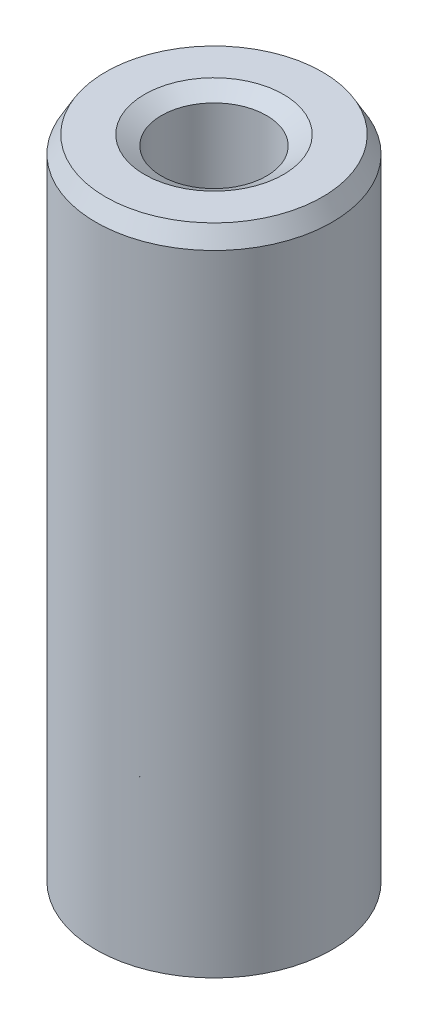
from build123d import *
from OCP.BRepFilletAPI import BRepFilletAPI_MakeChamfer

# Parameters (mm, degrees)
SKETCH1_R           = 17.5
BOSS_EXTRUDE1_DEPTH = 97.266417423
SKETCH2_R           = 7.778226496
CUT_EXTRUDE1_DEPTH  = 101.365611433
CHAMFER1_SIZE       = 2.512301637
CHAMFER1_SIZE2      = 1.450478026


with BuildPart() as part:
    # Sketch1 → Boss-Extrude1 (new body)
    with BuildSketch(Plane(origin=(0, 0, 0), x_dir=(1, 0, 0), z_dir=(0, 1, 0))):
        Circle(SKETCH1_R)
    extrude(amount=BOSS_EXTRUDE1_DEPTH)

    # Sketch2 → Cut-Extrude1 (cut, through all)
    with BuildSketch(Plane(origin=(0, 0, 0), x_dir=(1, 0, 0), z_dir=(0, 1, 0))):
        Circle(SKETCH2_R)
    extrude(amount=CUT_EXTRUDE1_DEPTH, mode=Mode.SUBTRACT)

    # Chamfer1: one chamfer whose edges measure the first distance from different faces: ONE call of the kernel's chamfer builder (chamfer() names one face for all edges)
    chamfer1_edges_1 = [part.edges().sort_by_distance(p)[0] for p in [
        (-7.778226496, 97.266417423, 0),
    ]]
    chamfer1_side_1 = [part.faces().sort_by_distance(p)[0] for p in [
        (-17.005025253, 97.266417423, 0),
    ]]
    chamfer1_edges_2 = [part.edges().sort_by_distance(p)[0] for p in [
        (-7.778226496, 0, 0),
    ]]
    chamfer1_side_2 = [part.faces().sort_by_distance(p)[0] for p in [
        (-7.778226496, 48.633208712, 0),
    ]]
    chamfer1_edges_3 = [part.edges().sort_by_distance(p)[0] for p in [
        (-17.5, 0, 0),
    ]]
    chamfer1_side_3 = [part.faces().sort_by_distance(p)[0] for p in [
        (-17.005025253, 0, 0),
    ]]
    chamfer1_edges_4 = [part.edges().sort_by_distance(p)[0] for p in [
        (-17.5, 97.266417423, 0),
    ]]
    chamfer1_side_4 = [part.faces().sort_by_distance(p)[0] for p in [
        (-17.5, 48.633208712, 0),
    ]]
    chamfer1 = BRepFilletAPI_MakeChamfer(part.part.solid().wrapped)
    for e in chamfer1_edges_1:
        chamfer1.Add(CHAMFER1_SIZE, CHAMFER1_SIZE2, e.wrapped, chamfer1_side_1[0].wrapped)  # the first distance lies on this face
    for e in chamfer1_edges_2:
        chamfer1.Add(CHAMFER1_SIZE, CHAMFER1_SIZE2, e.wrapped, chamfer1_side_2[0].wrapped)  # the first distance lies on this face
    for e in chamfer1_edges_3:
        chamfer1.Add(CHAMFER1_SIZE, CHAMFER1_SIZE2, e.wrapped, chamfer1_side_3[0].wrapped)  # the first distance lies on this face
    for e in chamfer1_edges_4:
        chamfer1.Add(CHAMFER1_SIZE, CHAMFER1_SIZE2, e.wrapped, chamfer1_side_4[0].wrapped)  # the first distance lies on this face
    add(Compound.cast(chamfer1.Shape()), mode=Mode.REPLACE)


solid = part.part
